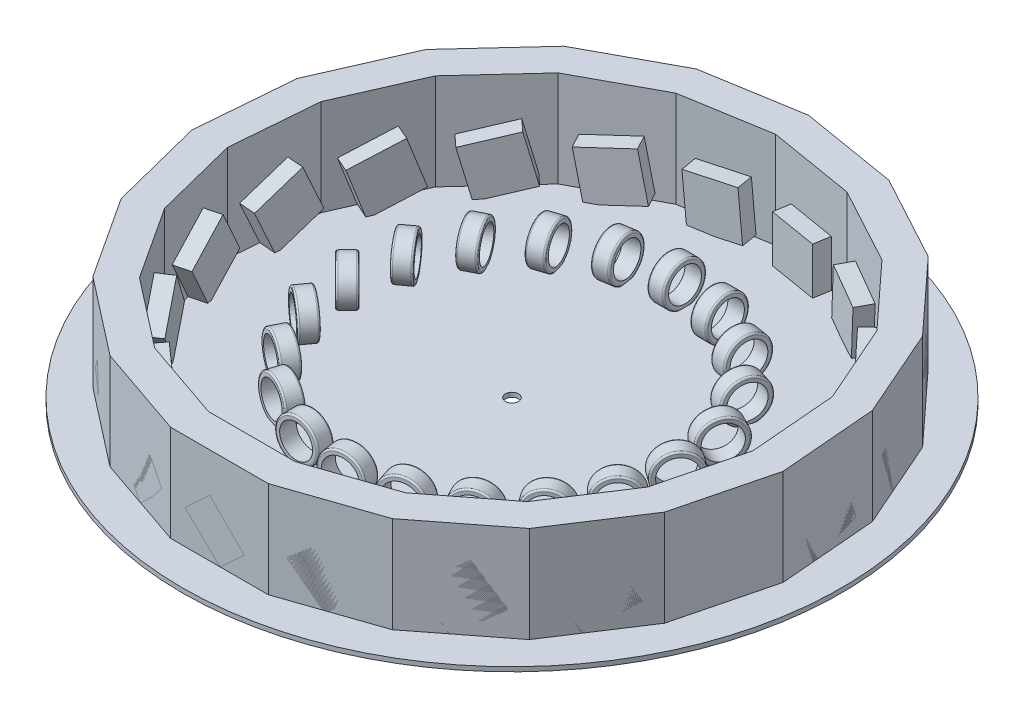
from build123d import *

# Parameters (mm, degrees)
SKETCH1_R                 = 100
SKETCH1_R_2               = 2.0000000000000018
BASE_PLATTER_DEPTH        = 0.75
CUBE_FACE_REFERENCE_DEPTH = 29.800000000000015
FIRST_CUBE_DEPTH          = 14.82
BOSS_EXTRUDE6_DEPTH       = 14.82
BOSS_EXTRUDE7_DEPTH       = 14.82
BOSS_EXTRUDE9_DEPTH       = 14.82
BOSS_EXTRUDE10_DEPTH      = 14.82
BOSS_EXTRUDE11_DEPTH      = 14.82
BOSS_EXTRUDE12_DEPTH      = 14.82
BOSS_EXTRUDE14_DEPTH      = 14.82
BOSS_EXTRUDE15_DEPTH      = 14.82
BOSS_EXTRUDE16_DEPTH      = 14.82
BOSS_EXTRUDE18_DEPTH      = 14.82
BOSS_EXTRUDE19_DEPTH      = 14.82
BOSS_EXTRUDE20_DEPTH      = 14.82
BOSS_EXTRUDE21_DEPTH      = 14.82
BOSS_EXTRUDE23_DEPTH      = 14.82
BOSS_EXTRUDE24_DEPTH      = 14.82
BOSS_EXTRUDE25_DEPTH      = 14.82
BOSS_EXTRUDE26_DEPTH      = 14.82
BOSS_EXTRUDE27_DEPTH      = 14.82
RINGS_DEPTH               = 13
SKETCH23_W                = 5.000000000000001
SKETCH23_H                = 13
RINGS_2_DEPTH             = 13
RINGS_3_DEPTH             = 13
RINGS_4_DEPTH             = 13
RINGS_5_DEPTH             = 13
RINGS_6_DEPTH             = 13
RINGS_7_DEPTH             = 13
RINGS_8_DEPTH             = 13
RINGS_9_DEPTH             = 13
RINGS_10_DEPTH            = 13
RINGS_11_DEPTH            = 13
RINGS_12_DEPTH            = 13
RINGS_13_DEPTH            = 13
RINGS_14_DEPTH            = 13
RINGS_15_DEPTH            = 13
RINGS_16_DEPTH            = 13
RINGS_17_DEPTH            = 13
RINGS_18_DEPTH            = 13
RINGS_19_DEPTH            = 13
RINGS_20_DEPTH            = 13
SKETCH26_R                = 4.999999999999997
CUT_EXTRUDE2_DEPTH        = 5
SKETCH27_R                = 4.999999999999997
CUT_EXTRUDE3_DEPTH        = 5
SKETCH28_R                = 4.999999999999997
CUT_EXTRUDE4_DEPTH        = 5
SKETCH29_R                = 4.999999999999997
CUT_EXTRUDE5_DEPTH        = 5
SKETCH30_R                = 4.999999999999997
CUT_EXTRUDE6_DEPTH        = 5
SKETCH31_R                = 4.999999999999997
CUT_EXTRUDE7_DEPTH        = 5
SKETCH32_R                = 4.999999999999997
CUT_EXTRUDE8_DEPTH        = 5
SKETCH33_R                = 5
CUT_EXTRUDE9_DEPTH        = 5
SKETCH34_R                = 4.999999999999998
CUT_EXTRUDE10_DEPTH       = 5
SKETCH35_R                = 4.999999999999998
CUT_EXTRUDE11_DEPTH       = 5
SKETCH36_R                = 5.000000000000003
CUT_EXTRUDE12_DEPTH       = 5
SKETCH37_R                = 5.0000000000000036
CUT_EXTRUDE13_DEPTH       = 5
SKETCH38_R                = 5
CUT_EXTRUDE14_DEPTH       = 5
SKETCH39_R                = 4.999999999999997
CUT_EXTRUDE15_DEPTH       = 5
SKETCH40_R                = 5
CUT_EXTRUDE16_DEPTH       = 5
SKETCH41_R                = 5
CUT_EXTRUDE17_DEPTH       = 5
SKETCH42_R                = 5.000000000000004
CUT_EXTRUDE18_DEPTH       = 5
SKETCH43_R                = 4.999999999999997
CUT_EXTRUDE19_DEPTH       = 5
SKETCH44_R                = 4.999999999999997
CUT_EXTRUDE20_DEPTH       = 5
SKETCH45_R                = 4.999999999999997
CUT_EXTRUDE21_DEPTH       = 5
SKETCH46_R                = 100
SKETCH46_R_2              = 2
BOSS_EXTRUDE29_DEPTH      = 0.6
FILLET1_R                 = 0.5


with BuildPart() as part:
    # Sketch1 → Base Platter (new body)
    with BuildSketch(Plane(origin=(0, 0, 0), x_dir=(1, 0, 0), z_dir=(0, 1, 0))):
        with Locations(Location((0, 0, 0), (0, 0, 270))):
            Circle(SKETCH1_R)
        with Locations(Location((0, 0, 0), (0, 0, 270))):
            Circle(SKETCH1_R_2, mode=Mode.SUBTRACT)
    extrude(amount=BASE_PLATTER_DEPTH)



with BuildPart() as body_2:
    # Sketch3 → Cube Face Reference (new body)
    with BuildSketch(Plane(origin=(0, 0.75, 0), x_dir=(1, 0, 0), z_dir=(0, 1, 0))):
        Polygon((2.429e-14, 90.00000000000001), (-29.222952228421583, 85.12355175305713), (-55.27914414207012, 71.02264584567544), (-75.34498304362761, 49.22533423101844), (-87.24602393453976, 22.093693842671932), (-89.69260437060031, -7.432141092509979), (-82.4195993989552, -36.152588218767285), (-66.21515196058188, -60.95534144631672), (-42.8352653733366, -79.15263760858409), (-14.813513125265956, -88.7725173062451), (14.813513125266049, -88.7725173062451), (42.83526537333665, -79.1526376085841), (66.21515196058186, -60.95534144631677), (82.41959939895521, -36.152588218767285), (89.69260437060034, -7.4321410925099265), (87.24602393453978, 22.09369384267194), (75.34498304362766, 49.225334231018365), (55.279144142070145, 71.02264584567543), (29.22295222842154, 85.12355175305714), align=None)
        Polygon((-2.776e-14, 80), (-25.97595753637474, 75.66537933605076), (-49.13701701517347, 63.131240751711445), (-66.9733182610023, 43.755852649794136), (-77.55202127514646, 19.638838971263908), (-79.7267594405336, -6.606347637786583), (-73.26186613240458, -32.13563397223765), (-58.85791285385055, -54.182525730059325), (-38.075791442965865, -70.3579000965192), (-13.1675672224587, -78.90890427221787), (13.167567222458729, -78.90890427221785), (38.075791442965894, -70.35790009651919), (58.85791285385056, -54.18252573005931), (73.2618661324046, -32.135633972237585), (79.72675944053361, -6.6063476377865165), (77.55202127514646, 19.63883897126394), (66.9733182610023, 43.75585264979415), (49.13701701517345, 63.13124075171147), (25.975957536374658, 75.66537933605078), align=None, mode=Mode.SUBTRACT)
    extrude(amount=CUBE_FACE_REFERENCE_DEPTH)


with BuildPart() as body_3:
    # Sketch4 → First Cube (new body)
    with BuildSketch(Plane(origin=(14.611476114210753, 0, -87.56177587652863), x_dir=(-0.9863613034027224, 0, -0.1645945902807338), z_dir=(0.1645945902807338, 0, -0.9863613034027224))):
        Polygon((-7.407500000000001, 0.75), (7.407500000000001, 0.75), (7.4075, 15.57), (-7.407500000000001, 15.57), align=None)
    extrude(amount=-FIRST_CUBE_DEPTH)


with BuildPart() as body_4:
    # Sketch5 → Boss-Extrude6 (new body)
    with BuildSketch(Plane(origin=(42.25104818524584, 0, -78.0730987993663), x_dir=(-0.879473751206489, 0, -0.4759473930370738), z_dir=(0.4759473930370738, 0, -0.879473751206489))):
        Polygon((-6.7727781432294405, 0.7500000000000014), (7.996604043129404, 1.9738258998999674), (6.77277814322944, 16.743208086258814), (-7.996604043129407, 15.519382186358849), align=None)
    extrude(amount=-BOSS_EXTRUDE6_DEPTH)


with BuildPart() as body_5:
    # Sketch6 → Boss-Extrude7 (new body)
    with BuildSketch(Plane(origin=(65.31206359284887, 0, -60.123990038346946), x_dir=(-0.6772815716257411, 0, -0.7357239106731317), z_dir=(0.7357239106731317, 0, -0.6772815716257411))):
        Polygon((-6.0892913442339935, 0.7500000000000014), (-8.528583172194372, 15.367874516428367), (6.089291344233993, 17.807166344388747), (8.528583172194367, 3.1892918279603784), align=None)
    extrude(amount=-BOSS_EXTRUDE7_DEPTH)


with BuildPart() as body_6:
    # Sketch7 → Boss-Extrude9 (new body)
    with BuildSketch(Plane(origin=(81.29550348908376, 0, -35.659514036845174), x_dir=(-0.4016954246529692, 0, -0.9157733266550576), z_dir=(0.9157733266550576, 0, -0.4016954246529692))):
        Polygon((-5.36420851089717, 0.75), (-9.002303430323744, 15.116511941220898), (5.364208510897154, 18.754606860647467), (9.002303430323721, 4.388094919426563), align=None)
    extrude(amount=-BOSS_EXTRUDE9_DEPTH)


with BuildPart() as body_7:
    # Sketch8 → Boss-Extrude10 (new body)
    with BuildSketch(Plane(origin=(88.46931415257009, 0, -7.330776375081016), x_dir=(-0.08257934547233238, 0, -0.9965844930066698), z_dir=(0.99658449300667, 0, -0.0825793454723324))):
        Polygon((-4.602482694195054, 0.75), (-9.414528827808395, 14.767011522003433), (4.602482694195035, 19.579057655616772), (9.414528827808367, 5.56204613361332), align=None)
    extrude(amount=-BOSS_EXTRUDE10_DEPTH)


with BuildPart() as body_8:
    # Sketch9 → Boss-Extrude11 (new body)
    with BuildSketch(Plane(origin=(86.05610188477782, 0, 21.792364655638615), x_dir=(0.24548548714079937, 0, -0.9694002659393304), z_dir=(0.9694002659393305, 0, 0.2454854871407994))):
        Polygon((3.8093172538355304, 20.274886894384913), (-9.76244344719246, 14.32176070102799), (-3.55e-15, 10.51244344719246), align=None)
        Polygon((-3.55e-15, 10.51244344719246), (9.762443447192455, 6.703126193356926), (3.80931725383553, 20.274886894384913), align=None)
        Polygon((-8.9e-16, 10.512443447192458), (-3.809317253835532, 0.7500000000000014), (9.762443447192455, 6.703126193356926), align=None)
        Polygon((-9.76244344719246, 14.32176070102799), (-3.809317253835532, 0.7500000000000014), (-8.9e-16, 10.512443447192458), align=None)
    extrude(amount=-BOSS_EXTRUDE11_DEPTH)


with BuildPart() as body_9:
    # Sketch10 → Boss-Extrude12 (new body)
    with BuildSketch(Plane(origin=(74.3173756797686, 0, 48.553964832542015), x_dir=(0.5469481581224269, 0, -0.8371664782625287), z_dir=(0.8371664782625287, 0, 0.5469481581224269))):
        Polygon((-2.990130314035431, 0.7500000000000022), (-10.043670678844782, 13.783800992880217), (2.9901303140354316, 20.83734135768956), (10.043670678844778, 7.803540364809351), align=None)
    extrude(amount=-BOSS_EXTRUDE12_DEPTH)


with BuildPart() as body_10:
    # Sketch11 → Boss-Extrude14 (new body)
    with BuildSketch(Plane(origin=(54.52520866695933, 0, 70.05398952745043), x_dir=(0.7891405093963932, 0, -0.6142127126896683), z_dir=(0.6142127126896683, 0, 0.7891405093963932))):
        Polygon((-2.1505177522381356, 0.7499999999999873), (-10.256289455612528, 13.156807207850639), (2.1505177522381262, 21.26257891122503), (10.256289455612519, 8.855771703374375), align=None)
    extrude(amount=-BOSS_EXTRUDE14_DEPTH)


with BuildPart() as body_11:
    # Sketch12 → Boss-Extrude15 (new body)
    with BuildSketch(Plane(origin=(28.82438924930138, 0, 83.96257745741461), x_dir=(0.9458172417006347, 0, -0.3246994692046836), z_dir=(0.3246994692046836, 0, 0.9458172417006347))):
        Polygon((-1.296214973596898, 0.750000000000002), (-10.398847375657711, 12.445062349254595), (1.296214973596889, 21.547694751315415), (10.3988473756577, 9.852632402060808), align=None)
    extrude(amount=-BOSS_EXTRUDE15_DEPTH)


with BuildPart() as body_12:
    # Sketch13 → Boss-Extrude16 (new body)
    with BuildSketch(Plane.XY.offset(88.7725173062451)):
        Polygon((-0.43305773234114836, 0.75), (-10.470370623834645, 11.653428356175802), (0.43305773234115635, 21.690741247669298), (10.470370623834652, 10.787312891493496), align=None)
    extrude(amount=-BOSS_EXTRUDE16_DEPTH)


with BuildPart() as body_13:
    # Sketch14 → Boss-Extrude18 (new body)
    with BuildSketch(Plane(origin=(-28.824389249301376, 0, 83.9625774574146), x_dir=(0.9458172417006347, 0, 0.3246994692046836), z_dir=(-0.3246994692046836, 0, 0.9458172417006347))):
        Polygon((0.43305773234112277, 0.75), (-10.470370623834645, 10.787312891493528), (-0.43305773234111367, 21.690741247669294), (10.470370623834652, 11.65342835617576), align=None)
    extrude(amount=-BOSS_EXTRUDE18_DEPTH)


with BuildPart() as body_14:
    # Sketch15 → Boss-Extrude19 (new body)
    with BuildSketch(Plane(origin=(-54.52520866695927, 0, 70.05398952745043), x_dir=(0.7891405093963937, 0, 0.6142127126896679), z_dir=(-0.6142127126896679, 0, 0.7891405093963937))):
        Polygon((1.2962149735968547, 0.7499999999999877), (-10.398847375657716, 9.852632402060836), (-1.296214973596866, 21.547694751315408), (10.398847375657706, 12.445062349254552), align=None)
    extrude(amount=-BOSS_EXTRUDE19_DEPTH)


with BuildPart() as body_15:
    # Sketch16 → Boss-Extrude20 (new body)
    with BuildSketch(Plane(origin=(-74.3173756797686, 0, 48.55396483254203), x_dir=(0.5469481581224271, 0, 0.8371664782625285), z_dir=(-0.8371664782625284, 0, 0.546948158122427))):
        Polygon((2.150517752238108, 0.7500000000000014), (-10.256289455612531, 8.855771703374419), (-2.150517752238109, 21.26257891122506), (10.256289455612528, 13.156807207850639), align=None)
    extrude(amount=-BOSS_EXTRUDE20_DEPTH)


with BuildPart() as body_16:
    # Sketch17 → Boss-Extrude21 (new body)
    with BuildSketch(Plane(origin=(-86.05610188477776, 0, 21.7923646556386), x_dir=(0.24548548714079926, 0, 0.9694002659393304), z_dir=(-0.9694002659393305, 0, 0.2454854871407993))):
        Polygon((2.9901303140353144, 0.7500000000000024), (-10.04367067884482, 7.8035403648095), (-2.99013031403532, 20.83734135768963), (10.043670678844812, 13.783800992880135), align=None)
    extrude(amount=-BOSS_EXTRUDE21_DEPTH)


with BuildPart() as body_17:
    # Sketch18 → Boss-Extrude23 (new body)
    with BuildSketch(Plane(origin=(-88.46931415257004, 0, -7.330776375080999), x_dir=(-0.08257934547233221, 0, 0.9965844930066698), z_dir=(-0.99658449300667, 0, -0.08257934547233223))):
        Polygon((3.8093172538354323, 0.7500000000000026), (-9.762443447192487, 6.703126193357057), (-3.809317253835426, 20.274886894384984), (9.7624434471925, 14.321760701027925), align=None)
    extrude(amount=-BOSS_EXTRUDE23_DEPTH)


with BuildPart() as body_18:
    # Sketch19 → Boss-Extrude24 (new body)
    with BuildSketch(Plane(origin=(-81.29550348908374, 0, -35.65951403684516), x_dir=(-0.40169542465296904, 0, 0.9157733266550577), z_dir=(-0.9157733266550576, 0, -0.401695424652969))):
        Polygon((4.602482694194955, 0.750000000000002), (-9.414528827808432, 5.5620461336134746), (-4.602482694194958, 19.579057655616857), (9.414528827808429, 14.767011522003386), align=None)
    extrude(amount=-BOSS_EXTRUDE24_DEPTH)


with BuildPart() as body_19:
    # Sketch20 → Boss-Extrude25 (new body)
    with BuildSketch(Plane(origin=(-65.31206359284884, 0, -60.12399003834697), x_dir=(-0.6772815716257413, 0, 0.7357239106731314), z_dir=(-0.7357239106731314, 0, -0.6772815716257413))):
        Polygon((5.364208510897141, 0.7500000000000011), (-9.002303430323746, 4.388094919426602), (-5.364208510897142, 18.75460686064749), (9.002303430323746, 15.116511941220885), align=None)
    extrude(amount=-BOSS_EXTRUDE25_DEPTH)


with BuildPart() as body_20:
    # Sketch21 → Boss-Extrude26 (new body)
    with BuildSketch(Plane(origin=(-42.251048185245864, 0, -78.07309879936632), x_dir=(-0.8794737512064889, 0, 0.47594739303707395), z_dir=(-0.47594739303707395, 0, -0.8794737512064889))):
        Polygon((6.089291344233902, 0.7499999999999994), (-8.528583172194436, 3.1892918279605356), (-6.089291344233897, 17.807166344388875), (8.528583172194441, 15.367874516428337), align=None)
    extrude(amount=-BOSS_EXTRUDE26_DEPTH)


with BuildPart() as body_21:
    # Sketch22 → Boss-Extrude27 (new body)
    with BuildSketch(Plane(origin=(-14.611476114210745, 0, -87.5617758765286), x_dir=(-0.9863613034027224, 0, 0.16459459028073373), z_dir=(-0.16459459028073373, 0, -0.9863613034027224))):
        Polygon((6.7727781432294645, 0.7499999999999885), (-7.9966040431293814, 1.9738258998998928), (-6.7727781432294725, 16.743208086258747), (7.996604043129378, 15.519382186358838), align=None)
    extrude(amount=-BOSS_EXTRUDE27_DEPTH)


with BuildPart() as body_22:
    # Sketch23 → Rings (new body)
    with BuildSketch(Plane(origin=(0, 0.75, 0), x_dir=(1, 0, 0), z_dir=(0, 1, 0))):
        Polygon((12.950849718747364, 54.052825814757675), (12.950849718747378, 41.05282581475768), (17.950849718747378, 41.05282581475769), (17.950849718747364, 54.05282581475769), align=None)
    extrude(amount=RINGS_DEPTH)

    # Sketch28 → Cut-Extrude4 (cut)
    with BuildSketch(Plane(origin=(17.950849718747424, 0, -1.916e-14), x_dir=(-1.6e-15, 0, -1), z_dir=(1, 0, -1.6e-15))):
        with BuildLine():
            Line((47.552825814758314, 13.75), (41.05282581475766, 13.75))
            Line((41.05282581475766, 13.75), (41.05282581475766, 7.250000000000003))
            ThreePointArc((41.052825814757654, 7.250000000000001), (42.95663173704533, 11.846194077712795), (47.552825814758314, 13.75))
        make_face()
        with BuildLine():
            ThreePointArc((47.55282581475831, 0.7499999999999991), (42.95663173704533, 2.6538059222872104), (41.052825814757654, 7.250000000000001))
            Line((41.05282581475766, 7.250000000000003), (41.05282581475766, 0.75))
            Line((41.05282581475766, 0.75), (47.55282581475831, 0.75))
        make_face()
        with Locations((47.552825814757654, 7.25)):
            Circle(SKETCH28_R)
        with BuildLine():
            Line((54.052825814757654, 13.75), (47.552825814758314, 13.75))
            ThreePointArc((47.552825814758314, 13.75), (52.14901989247045, 11.846194077712326), (54.052825814757654, 7.25))
            Line((54.052825814757654, 7.25), (54.052825814757654, 13.75))
        make_face()
        with BuildLine():
            Line((54.052825814757654, 0.75), (54.052825814757654, 7.25))
            ThreePointArc((54.052825814757654, 7.249999999999998), (52.14901989247045, 2.653805922287672), (47.55282581475831, 0.7499999999999991))
            Line((47.55282581475831, 0.75), (54.052825814757654, 0.75))
        make_face()
    extrude(amount=-CUT_EXTRUDE4_DEPTH, mode=Mode.SUBTRACT)


with BuildPart() as body_23:
    # Sketch23 → Rings 2 (new body)
    with BuildSketch(Plane(origin=(0, 0.75, 0), x_dir=(1, 0, 0), z_dir=(0, 1, 0))):
        with Locations((-1.78e-15, 50.00000000000001)):
            Rectangle(SKETCH23_W, SKETCH23_H)
    extrude(amount=RINGS_2_DEPTH)

    # Sketch27 → Cut-Extrude3 (cut)
    with BuildSketch(Plane(origin=(2.4999999999999987, 0, 0), x_dir=(0, 0, -1), z_dir=(1, 0, 0))):
        with Locations((50, 7.25)):
            Circle(SKETCH27_R)
        with BuildLine():
            Line((50.00000000000066, 13.75), (43.50000000000001, 13.75))
            Line((43.50000000000001, 13.75), (43.50000000000001, 7.249999999999998))
            ThreePointArc((43.5, 7.250000000000001), (45.403805922287674, 11.846194077712795), (50.00000000000066, 13.75))
        make_face()
        with BuildLine():
            ThreePointArc((50.000000000000654, 0.7499999999999991), (45.403805922287674, 2.6538059222872104), (43.5, 7.250000000000001))
            Line((43.50000000000001, 7.249999999999998), (43.50000000000001, 0.75))
            Line((43.50000000000001, 0.75), (50.000000000000654, 0.75))
        make_face()
        with BuildLine():
            Line((56.5, 13.75), (50.00000000000066, 13.75))
            ThreePointArc((50.00000000000066, 13.75), (54.596194077712795, 11.846194077712326), (56.5, 7.25))
            Line((56.5, 7.25), (56.5, 13.75))
        make_face()
        with BuildLine():
            Line((56.5, 0.75), (56.5, 7.25))
            ThreePointArc((56.5, 7.249999999999998), (54.596194077712795, 2.653805922287672), (50.000000000000654, 0.7499999999999991))
            Line((50.000000000000654, 0.75), (56.5, 0.75))
        make_face()
    extrude(amount=-CUT_EXTRUDE3_DEPTH, mode=Mode.SUBTRACT)


with BuildPart() as body_24:
    # Sketch23 → Rings 3 (new body)
    with BuildSketch(Plane(origin=(0, 0.75, 0), x_dir=(1, 0, 0), z_dir=(0, 1, 0))):
        Polygon((27.93686578589736, 47.26191009521636), (32.87530748887305, 46.47973777001518), (30.84165944334997, 33.639789342278405), (25.903217740374274, 34.421961667479586), align=None)
    extrude(amount=RINGS_3_DEPTH)

    # Sketch29 → Cut-Extrude5 (cut)
    with BuildSketch(Plane(origin=(24.889277018173086, 0, 3.94207421060584), x_dir=(0.15643446504023656, 0, -0.9876883405951369), z_dir=(0.9876883405951368, 0, 0.15643446504023653))):
        with Locations((44.55032620941853, 7.25)):
            Circle(SKETCH29_R)
        with BuildLine():
            Line((44.55032620941919, 13.75), (38.050326209418536, 13.75))
            Line((38.050326209418536, 13.75), (38.050326209418536, 7.249999999999996))
            ThreePointArc((38.05032620941853, 7.250000000000001), (39.9541321317062, 11.846194077712795), (44.55032620941919, 13.75))
        make_face()
        with BuildLine():
            ThreePointArc((44.55032620941918, 0.7499999999999991), (39.9541321317062, 2.6538059222872104), (38.05032620941853, 7.250000000000001))
            Line((38.050326209418536, 7.249999999999996), (38.050326209418536, 0.75))
            Line((38.050326209418536, 0.75), (44.55032620941918, 0.75))
        make_face()
        with BuildLine():
            Line((51.05032620941852, 0.75), (51.05032620941853, 7.25))
            ThreePointArc((51.05032620941853, 7.249999999999998), (49.146520287131324, 2.653805922287672), (44.55032620941918, 0.7499999999999991))
            Line((44.55032620941918, 0.75), (51.05032620941852, 0.75))
        make_face()
        with BuildLine():
            Line((51.05032620941853, 13.75), (44.55032620941919, 13.75))
            ThreePointArc((44.55032620941919, 13.75), (49.146520287131324, 11.846194077712326), (51.05032620941853, 7.25))
            Line((51.05032620941853, 7.25), (51.05032620941853, 13.75))
        make_face()
    extrude(amount=-CUT_EXTRUDE5_DEPTH, mode=Mode.SUBTRACT)


with BuildPart() as body_25:
    # Sketch23 → Rings 4 (new body)
    with BuildSketch(Plane(origin=(0, 0.75, 0), x_dir=(1, 0, 0), z_dir=(0, 1, 0))):
        Polygon((40.08181889144664, 36.343672456479524), (36.06459796457236, 23.979937744642513), (40.81988054604812, 22.434852772767794), (44.837101472922406, 34.798587484604795), align=None)
    extrude(amount=RINGS_4_DEPTH)

    # Sketch30 → Cut-Extrude6 (cut)
    with BuildSketch(Plane(origin=(30.32849100948537, 0, 9.854324086004343), x_dir=(0.3090169943749453, 0, -0.9510565162951543), z_dir=(0.9510565162951544, 0, 0.3090169943749453))):
        with BuildLine():
            Line((40.45084971874796, 13.75), (33.9508497187473, 13.75))
            Line((33.9508497187473, 13.75), (33.9508497187473, 7.250000000000006))
            ThreePointArc((33.9508497187473, 7.250000000000001), (35.854655641034974, 11.846194077712795), (40.45084971874796, 13.75))
        make_face()
        with BuildLine():
            ThreePointArc((40.45084971874795, 0.7499999999999991), (35.85465564103497, 2.6538059222872104), (33.9508497187473, 7.250000000000001))
            Line((33.9508497187473, 7.250000000000006), (33.9508497187473, 0.75))
            Line((33.9508497187473, 0.75), (40.45084971874795, 0.75))
        make_face()
        with Locations((40.4508497187473, 7.25)):
            Circle(SKETCH30_R)
        with BuildLine():
            Line((46.9508497187473, 13.75), (40.45084971874796, 13.75))
            ThreePointArc((40.45084971874796, 13.75), (45.047043796460095, 11.846194077712326), (46.9508497187473, 7.25))
            Line((46.9508497187473, 7.25), (46.9508497187473, 13.75))
        make_face()
        with BuildLine():
            Line((46.9508497187473, 0.75), (46.9508497187473, 7.25))
            ThreePointArc((46.9508497187473, 7.249999999999998), (45.04704379646009, 2.653805922287672), (40.45084971874795, 0.7499999999999991))
            Line((40.45084971874795, 0.75), (46.9508497187473, 0.75))
        make_face()
    extrude(amount=-CUT_EXTRUDE6_DEPTH, mode=Mode.SUBTRACT)


with BuildPart() as body_26:
    # Sketch23 → Rings 5 (new body)
    with BuildSketch(Plane(origin=(0, 0.75, 0), x_dir=(1, 0, 0), z_dir=(0, 1, 0))):
        Polygon((48.276247752593804, 22.377368375320636), (42.37437125597971, 10.794283560871845), (46.82940387692156, 8.524331062174118), (52.73128037353565, 20.10741587662291), align=None)
    extrude(amount=RINGS_5_DEPTH)

    # Sketch31 → Cut-Extrude7 (cut)
    with BuildSketch(Plane(origin=(33.72935407722357, 0, 17.185964297354), x_dir=(0.4539904997395454, 0, -0.8910065241883687), z_dir=(0.8910065241883686, 0, 0.45399049973954536))):
        with BuildLine():
            Line((35.35533905932799, 13.75), (28.85533905932733, 13.75))
            Line((28.85533905932733, 13.75), (28.85533905932733, 7.25))
            ThreePointArc((28.855339059327328, 7.250000000000001), (30.759144981615, 11.846194077712795), (35.35533905932799, 13.75))
        make_face()
        with BuildLine():
            ThreePointArc((35.35533905932798, 0.7499999999999991), (30.759144981614998, 2.6538059222872104), (28.855339059327328, 7.250000000000001))
            Line((28.85533905932733, 7.25), (28.85533905932733, 0.75))
            Line((28.85533905932733, 0.75), (35.35533905932798, 0.75))
        make_face()
        with Locations((35.35533905932733, 7.25)):
            Circle(SKETCH31_R)
        with BuildLine():
            Line((41.855339059327335, 13.75), (35.35533905932799, 13.75))
            ThreePointArc((35.35533905932799, 13.75), (39.95153313704012, 11.846194077712326), (41.85533905932733, 7.25))
            Line((41.855339059327335, 7.25), (41.855339059327335, 13.75))
        make_face()
        with BuildLine():
            Line((41.85533905932733, 0.75), (41.855339059327335, 7.25))
            ThreePointArc((41.85533905932733, 7.249999999999998), (39.951533137040116, 2.653805922287672), (35.35533905932798, 0.7499999999999991))
            Line((35.35533905932798, 0.75), (41.85533905932733, 0.75))
        make_face()
    extrude(amount=-CUT_EXTRUDE7_DEPTH, mode=Mode.SUBTRACT)


with BuildPart() as body_27:
    # Sketch23 → Rings 6 (new body)
    with BuildSketch(Plane(origin=(0, 0.75, 0), x_dir=(1, 0, 0), z_dir=(0, 1, 0))):
        Polygon((51.79806165396369, 6.7280735941683485), (44.156853374161564, -3.789147332705984), (48.20193834603631, -6.728073594168339), (55.84314662583844, 3.7891473327059897), align=None)
    extrude(amount=RINGS_6_DEPTH)

    # Sketch32 → Cut-Extrude8 (cut)
    with BuildSketch(Plane(origin=(34.74796734531116, 0, 25.245876038109998), x_dir=(0.5877852522924715, 0, -0.8090169943749487), z_dir=(0.8090169943749487, 0, 0.5877852522924715))):
        with BuildLine():
            Line((29.389262614624226, 13.75), (22.889262614623572, 13.75))
            Line((22.889262614623572, 13.75), (22.889262614623572, 7.2500000000000036))
            ThreePointArc((22.889262614623565, 7.250000000000001), (24.793068536911242, 11.846194077712795), (29.389262614624226, 13.75))
        make_face()
        with BuildLine():
            ThreePointArc((29.38926261462421, 0.7499999999999991), (24.793068536911232, 2.653805922287213), (22.889262614623565, 7.250000000000001))
            Line((22.889262614623572, 7.2500000000000036), (22.889262614623572, 0.75))
            Line((22.889262614623572, 0.75), (29.389262614624215, 0.75))
        make_face()
        with Locations((29.389262614623565, 7.25)):
            Circle(SKETCH32_R)
        with BuildLine():
            Line((35.889262614623576, 13.75), (29.389262614624226, 13.75))
            ThreePointArc((29.389262614624226, 13.75), (33.985456692336356, 11.846194077712326), (35.88926261462357, 7.25))
            Line((35.889262614623576, 7.25), (35.889262614623576, 13.75))
        make_face()
        with BuildLine():
            Line((35.88926261462357, 0.75), (35.889262614623576, 7.25))
            ThreePointArc((35.88926261462357, 7.249999999999998), (33.98545669233635, 2.6538059222876678), (29.38926261462421, 0.7499999999999991))
            Line((29.389262614624215, 0.75), (35.88926261462357, 0.75))
        make_face()
    extrude(amount=-CUT_EXTRUDE8_DEPTH, mode=Mode.SUBTRACT)


with BuildPart() as body_28:
    # Sketch23 → Rings 7 (new body)
    with BuildSketch(Plane(origin=(0, 0.75, 0), x_dir=(1, 0, 0), z_dir=(0, 1, 0))):
        Polygon((50.38125293950386, -9.08688868806843), (41.18886478407877, -18.279276843493562), (44.72439869001151, -21.8148107494263), (53.916786845436604, -12.622422594001156), align=None)
    extrude(amount=RINGS_7_DEPTH)

    # Sketch33 → Cut-Extrude9 (cut)
    with BuildSketch(Plane(origin=(33.26960471971901, 0, 33.26960471971885), x_dir=(0.7071067811865459, 0, -0.7071067811865492), z_dir=(0.7071067811865492, 0, 0.7071067811865459))):
        with BuildLine():
            Line((22.69952498697788, 13.75), (16.19952498697722, 13.75))
            Line((16.19952498697722, 13.75), (16.19952498697722, 7.249999999999998))
            ThreePointArc((16.19952498697722, 7.250000000000001), (18.103330909264898, 11.846194077712795), (22.69952498697788, 13.75))
        make_face()
        with BuildLine():
            ThreePointArc((22.699524986977867, 0.7499999999999991), (18.103330909264887, 2.653805922287213), (16.19952498697722, 7.250000000000001))
            Line((16.19952498697722, 7.249999999999998), (16.19952498697722, 0.75))
            Line((16.19952498697722, 0.75), (22.69952498697787, 0.75))
        make_face()
        with Locations((22.69952498697722, 7.25)):
            Circle(SKETCH33_R)
        with BuildLine():
            Line((29.19952498697722, 13.75), (22.69952498697788, 13.75))
            ThreePointArc((22.69952498697788, 13.75), (27.295719064690015, 11.846194077712326), (29.19952498697722, 7.25))
            Line((29.19952498697722, 7.25), (29.19952498697722, 13.75))
        make_face()
        with BuildLine():
            Line((29.19952498697722, 0.75), (29.19952498697722, 7.25))
            ThreePointArc((29.19952498697722, 7.249999999999998), (27.295719064690008, 2.6538059222876678), (22.699524986977867, 0.7499999999999991))
            Line((22.69952498697787, 0.75), (29.19952498697722, 0.75))
        make_face()
    extrude(amount=-CUT_EXTRUDE9_DEPTH, mode=Mode.SUBTRACT)


with BuildPart() as body_29:
    # Sketch23 → Rings 8 (new body)
    with BuildSketch(Plane(origin=(0, 0.75, 0), x_dir=(1, 0, 0), z_dir=(0, 1, 0))):
        Polygon((44.23999705145333, -23.546115988785207), (33.72277612457904, -31.187324268587382), (36.661702386041426, -35.23240924046211), (47.178923312915714, -27.59120096065992), align=None)
    extrude(amount=RINGS_8_DEPTH)

    # Sketch34 → Cut-Extrude10 (cut)
    with BuildSketch(Plane(origin=(29.420312849478744, 0, 40.493586700628), x_dir=(0.8090169943749453, 0, -0.587785252292476), z_dir=(0.587785252292476, 0, 0.8090169943749453))):
        with BuildLine():
            ThreePointArc((15.450849718747847, 0.7499999999999964), (10.854655641034867, 2.6538059222872112), (8.950849718747198, 7.250000000000001))
            Line((8.950849718747206, 7.249999999999997), (8.950849718747206, 0.75))
            Line((8.950849718747206, 0.75), (15.450849718747847, 0.75))
        make_face()
        with BuildLine():
            Line((15.450849718747865, 13.75), (8.950849718747204, 13.75))
            Line((8.950849718747204, 13.75), (8.950849718747206, 7.249999999999997))
            ThreePointArc((8.950849718747198, 7.250000000000001), (10.854655641034874, 11.846194077712795), (15.450849718747865, 13.750000000000004))
        make_face()
        with Locations((15.450849718747202, 7.25)):
            Circle(SKETCH34_R)
        with BuildLine():
            Line((21.950849718747204, 13.75), (15.450849718747865, 13.75))
            ThreePointArc((15.450849718747865, 13.750000000000004), (20.04704379646, 11.846194077712326), (21.950849718747207, 7.25))
            Line((21.9508497187472, 7.25), (21.950849718747204, 13.75))
        make_face()
        with BuildLine():
            Line((21.9508497187472, 0.75), (21.9508497187472, 7.25))
            ThreePointArc((21.950849718747207, 7.249999999999998), (20.04704379645999, 2.653805922287666), (15.450849718747847, 0.7499999999999964))
            Line((15.450849718747847, 0.75), (21.9508497187472, 0.75))
        make_face()
    extrude(amount=-CUT_EXTRUDE10_DEPTH, mode=Mode.SUBTRACT)


with BuildPart() as body_30:
    # Sketch23 → Rings 9 (new body)
    with BuildSketch(Plane(origin=(0, 0.75, 0), x_dir=(1, 0, 0), z_dir=(0, 1, 0))):
        Polygon((24.732696456748155, -45.62930427752535), (36.31578127119692, -39.727427780911206), (34.04582877249917, -35.27239515996938), (22.462743958050414, -41.17427165658352), align=None)
    extrude(amount=RINGS_9_DEPTH)

    # Sketch35 → Cut-Extrude11 (cut)
    with BuildSketch(Plane(origin=(23.555032416034535, 0, 46.22935407722339), x_dir=(0.8910065241883667, 0, -0.4539904997395491), z_dir=(0.4539904997395491, 0, 0.8910065241883667))):
        with BuildLine():
            ThreePointArc((7.821723265308285, 0.7499999999999982), (3.2255291813504767, 2.6538059152358437), (1.3217232520114388, 7.249999993351919))
            Line((1.3217232520114406, 7.249999993351918), (1.3217232520114413, 0.75))
            Line((1.3217232520114413, 0.75), (7.821723265308285, 0.75))
        make_face()
        with BuildLine():
            Line((7.821723252012102, 13.75), (1.32172325201144, 13.75))
            Line((1.32172325201144, 13.75), (1.3217232520114406, 7.249999993351918))
            ThreePointArc((1.3217232520114388, 7.249999993351919), (3.2255291719486614, 11.846194075362341), (7.821723252012102, 13.750000000000002))
        make_face()
        with Locations((7.821723252011441, 7.25)):
            Circle(SKETCH35_R)
        with BuildLine():
            Line((14.32172325201144, 13.75), (7.821723252012102, 13.75))
            ThreePointArc((7.821723252012102, 13.750000000000002), (12.417917329724235, 11.846194077712326), (14.321723252011441, 7.25))
            Line((14.321723252011441, 7.25), (14.32172325201144, 13.75))
        make_face()
        with BuildLine():
            Line((14.321723252011441, 0.75), (14.321723252011441, 7.25))
            ThreePointArc((14.321723252011441, 7.249999999999998), (12.417917334425145, 2.653805926988583), (7.821723265308285, 0.7499999999999982))
            Line((7.821723265308285, 0.75), (14.321723252011441, 0.75))
        make_face()
    extrude(amount=-CUT_EXTRUDE11_DEPTH, mode=Mode.SUBTRACT)


with BuildPart() as body_31:
    # Sketch23 → Rings 10 (new body)
    with BuildSketch(Plane(origin=(0, 0.75, 0), x_dir=(1, 0, 0), z_dir=(0, 1, 0))):
        Polygon((10.041524848766262, -51.93907756893273), (22.40525956060324, -47.92185664205839), (20.860174588728487, -43.16657406058262), (8.49643987689151, -47.18379498745698), align=None)
    extrude(amount=RINGS_10_DEPTH)

    # Sketch36 → Cut-Extrude12 (cut)
    with BuildSketch(Plane(origin=(16.22339220468489, 0, 49.93046710549556), x_dir=(0.9510565162951524, 0, -0.30901699437495117), z_dir=(0.3090169943749511, 0, 0.9510565162951523))):
        with BuildLine():
            Line((6.6169e-13, 13.75), (-6.500000000000188, 13.75))
            Line((-6.500000000000188, 13.75), (-6.500000000000187, 7.249999999999998))
            ThreePointArc((-6.500000000000002, 7.250000000000001), (-4.596194077712328, 11.846194077712793), (6.6142e-13, 13.750000000000002))
        make_face()
        with BuildLine():
            ThreePointArc((-4.302674869e-08, 0.7499999999999982), (-4.596194092924813, 2.653805937499693), (-6.500000000000002, 7.250000000000001))
            Line((-6.500000000000187, 7.249999999999998), (-6.5000000000001865, 0.75))
            Line((-6.5000000000001865, 0.75), (-4.302674839e-08, 0.75))
        make_face()
        with Locations((0, 7.25)):
            Circle(SKETCH36_R)
        with BuildLine():
            Line((6.49999999999981, 0.75), (6.499999999999811, 7.25))
            ThreePointArc((6.500000000000002, 7.249999999999998), (4.596194062500307, 2.6538059070751867), (-4.302674869e-08, 0.7499999999999982))
            Line((-4.302674839e-08, 0.75), (6.49999999999981, 0.75))
        make_face()
        with BuildLine():
            Line((6.499999999999812, 13.75), (6.6169e-13, 13.75))
            ThreePointArc((6.6142e-13, 13.750000000000002), (4.596194077712794, 11.846194077712326), (6.500000000000002, 7.25))
            Line((6.499999999999811, 7.25), (6.499999999999812, 13.75))
        make_face()
    extrude(amount=-CUT_EXTRUDE12_DEPTH, mode=Mode.SUBTRACT)


with BuildPart() as body_32:
    # Sketch23 → Rings 11 (new body)
    with BuildSketch(Plane(origin=(0, 0.75, 0), x_dir=(1, 0, 0), z_dir=(0, 1, 0))):
        Polygon((-6.0288880512678, -53.48604487424937), (6.811060376468982, -51.45239682872633), (6.02888805126781, -46.51395512575064), (-6.811060376468971, -48.547603171273686), align=None)
    extrude(amount=RINGS_11_DEPTH)

    # Sketch37 → Cut-Extrude13 (cut)
    with BuildSketch(Plane(origin=(8.116511021974425, 0, 51.24563375886664), x_dir=(0.9876883405951373, 0, -0.156434465040234), z_dir=(0.156434465040234, 0, 0.9876883405951373))):
        with BuildLine():
            Line((-14.321723252011694, 13.75), (-14.321723252011694, 7.250000000000006))
            ThreePointArc((-14.321723252011697, 7.250000000000001), (-12.417917329724235, 11.846194077712582), (-7.821723252011638, 13.750000000000002))
            Line((-7.821723252011638, 13.750000000000002), (-14.321723252011694, 13.75))
        make_face()
        with BuildLine():
            Line((-14.321723252011694, 0.7499999999999983), (-7.821723245362948, 0.7499999999999992))
            ThreePointArc((-7.821723245362951, 0.7499999999999982), (-12.41791732737357, 2.6538059199367536), (-14.321723252011697, 7.250000000000001))
            Line((-14.321723252011694, 7.250000000000006), (-14.321723252011694, 0.7499999999999983))
        make_face()
        with Locations((-7.8217232520116955, 7.25)):
            Circle(SKETCH37_R)
        with BuildLine():
            ThreePointArc((-7.821723252011639, 13.750000000000002), (-3.2255291742991155, 11.84619407771254), (-1.3217232520116937, 7.25))
            Line((-1.3217232520116955, 7.25), (-1.3217232520116964, 13.750000000000004))
            Line((-1.3217232520116964, 13.750000000000004), (-7.821723252011638, 13.750000000000002))
        make_face()
        with BuildLine():
            Line((-7.821723245362948, 0.7499999999999992), (-1.3217232520116948, 0.75))
            Line((-1.3217232520116948, 0.75), (-1.3217232520116955, 7.25))
            ThreePointArc((-1.3217232520116937, 7.249999999999998), (-3.2255291719484473, 2.653805924638127), (-7.821723245362951, 0.7499999999999982))
        make_face()
    extrude(amount=-CUT_EXTRUDE13_DEPTH, mode=Mode.SUBTRACT)


with BuildPart() as body_33:
    # Sketch23 → Rings 12 (new body)
    with BuildSketch(Plane(origin=(0, 0.75, 0), x_dir=(1, 0, 0), z_dir=(0, 1, 0))):
        Polygon((-21.950849718747353, -50.0528258147577), (-8.950849718747358, -50.05282581475765), (-8.950849718747381, -45.05282581475765), (-21.950849718747378, -45.05282581475771), align=None)
    extrude(amount=RINGS_12_DEPTH)

    # Sketch38 → Cut-Extrude14 (cut)
    with BuildSketch(Plane.XY.offset(50.052825814757604)):
        with BuildLine():
            Line((-15.450849718746888, 13.75), (-21.950849718747563, 13.75))
            Line((-21.950849718747563, 13.75), (-21.950849718747563, 7.250000000000006))
            ThreePointArc((-21.950849718747563, 7.250000000000001), (-20.04704379645988, 11.846194077712799), (-15.450849718746888, 13.75))
        make_face()
        with BuildLine():
            ThreePointArc((-15.450849718746896, 0.7500000000000009), (-20.047043796459885, 2.653805922287205), (-21.950849718747563, 7.250000000000001))
            Line((-21.950849718747563, 7.250000000000006), (-21.950849718747563, 0.75))
            Line((-21.950849718747563, 0.75), (-15.450849718746896, 0.75))
        make_face()
        with Locations((-15.450849718747564, 7.25)):
            Circle(SKETCH38_R)
        with BuildLine():
            Line((-8.950849718747563, 13.75), (-15.450849718746888, 13.75))
            ThreePointArc((-15.450849718746888, 13.75), (-10.854655641034768, 11.846194077712319), (-8.950849718747566, 7.25))
            Line((-8.950849718747563, 7.25), (-8.950849718747563, 13.75))
        make_face()
        with BuildLine():
            Line((-8.950849718747564, 0.75), (-8.950849718747563, 7.25))
            ThreePointArc((-8.950849718747566, 7.249999999999998), (-10.854655641034771, 2.6538059222876775), (-15.450849718746896, 0.7500000000000009))
            Line((-15.450849718746896, 0.75), (-8.950849718747564, 0.75))
        make_face()
    extrude(amount=-CUT_EXTRUDE14_DEPTH, mode=Mode.SUBTRACT)


with BuildPart() as body_34:
    # Sketch23 → Rings 13 (new body)
    with BuildSketch(Plane(origin=(0, 0.75, 0), x_dir=(1, 0, 0), z_dir=(0, 1, 0))):
        Polygon((-36.343672456479524, -40.81988054604816), (-23.979937744642502, -44.83710147292241), (-22.434852772767787, -40.08181889144664), (-34.798587484604816, -36.064597964572386), align=None)
    extrude(amount=RINGS_13_DEPTH)

    # Sketch39 → Cut-Extrude15 (cut)
    with BuildSketch(Plane(origin=(-15.467173793248943, 0, 47.60306615011162), x_dir=(0.9510565162951552, 0, 0.3090169943749427), z_dir=(-0.3090169943749426, 0, 0.9510565162951551))):
        with BuildLine():
            Line((-15.450849718746932, 13.75), (-21.950849718747605, 13.75))
            Line((-21.950849718747605, 13.75), (-21.950849718747605, 7.250000000000001))
            ThreePointArc((-21.95084971874761, 7.250000000000001), (-20.047043796459928, 11.846194077712799), (-15.450849718746932, 13.75))
        make_face()
        with BuildLine():
            ThreePointArc((-15.450849718746941, 0.7500000000000009), (-20.04704379645993, 2.653805922287205), (-21.95084971874761, 7.250000000000001))
            Line((-21.950849718747605, 7.250000000000001), (-21.950849718747605, 0.75))
            Line((-21.950849718747605, 0.75), (-15.450849718746941, 0.75))
        make_face()
        with BuildLine():
            Line((-8.950849718747605, 13.75), (-15.450849718746932, 13.75))
            ThreePointArc((-15.450849718746932, 13.75), (-10.85465564103481, 11.846194077712319), (-8.950849718747609, 7.25))
            Line((-8.950849718747609, 7.25), (-8.950849718747605, 13.75))
        make_face()
        with Locations((-15.450849718747609, 7.25)):
            Circle(SKETCH39_R)
        with BuildLine():
            Line((-8.950849718747614, 0.75), (-8.950849718747609, 7.25))
            ThreePointArc((-8.950849718747609, 7.249999999999998), (-10.854655641034814, 2.6538059222876775), (-15.450849718746941, 0.7500000000000009))
            Line((-15.450849718746941, 0.75), (-8.950849718747614, 0.75))
        make_face()
    extrude(amount=-CUT_EXTRUDE15_DEPTH, mode=Mode.SUBTRACT)


with BuildPart() as body_35:
    # Sketch23 → Rings 14 (new body)
    with BuildSketch(Plane(origin=(0, 0.75, 0), x_dir=(1, 0, 0), z_dir=(0, 1, 0))):
        Polygon((-47.377368375320636, -28.66584067678756), (-35.794283560871826, -34.56771717340162), (-33.52433106217411, -30.11268455245976), (-45.10741587662292, -24.210808055845714), align=None)
    extrude(amount=RINGS_14_DEPTH)

    # Sketch40 → Cut-Extrude16 (cut)
    with BuildSketch(Plane(origin=(-21.36040110872232, 0, 41.92214761778279), x_dir=(0.8910065241883703, 0, 0.45399049973954203), z_dir=(-0.453990499739542, 0, 0.8910065241883702))):
        with BuildLine():
            Line((-22.699524986976915, 13.75), (-29.19952498697757, 13.75))
            Line((-29.19952498697757, 13.75), (-29.19952498697757, 7.249999999999997))
            ThreePointArc((-29.199524986977575, 7.250000000000001), (-27.295719064689898, 11.846194077712795), (-22.699524986976915, 13.75))
        make_face()
        with BuildLine():
            Line((-16.19952498697757, 13.75), (-22.699524986976915, 13.75))
            ThreePointArc((-22.699524986976915, 13.75), (-18.10333090926478, 11.846194077712326), (-16.199524986977575, 7.25))
            Line((-16.199524986977572, 7.25), (-16.19952498697757, 13.75))
        make_face()
        with Locations((-22.699524986977575, 7.25)):
            Circle(SKETCH40_R)
        with BuildLine():
            Line((-16.19952498697758, 0.75), (-16.199524986977572, 7.25))
            ThreePointArc((-16.199524986977575, 7.249999999999998), (-18.103330909264788, 2.6538059222876678), (-22.69952498697693, 0.7499999999999991))
            Line((-22.699524986976925, 0.75), (-16.19952498697758, 0.75))
        make_face()
        with BuildLine():
            ThreePointArc((-22.69952498697693, 0.7499999999999991), (-27.29571906468991, 2.653805922287213), (-29.199524986977575, 7.250000000000001))
            Line((-29.19952498697757, 7.249999999999997), (-29.19952498697757, 0.75))
            Line((-29.19952498697757, 0.75), (-22.699524986976925, 0.75))
        make_face()
    extrude(amount=-CUT_EXTRUDE16_DEPTH, mode=Mode.SUBTRACT)


with BuildPart() as body_36:
    # Sketch23 → Rings 15 (new body)
    with BuildSketch(Plane(origin=(0, 0.75, 0), x_dir=(1, 0, 0), z_dir=(0, 1, 0))):
        Polygon((-54.28089940892603, -13.652788064783714), (-43.76367848205167, -21.293996344585803), (-40.824752220589325, -17.248911372711042), (-51.34197314746369, -9.60770309290896), align=None)
    extrude(amount=RINGS_15_DEPTH)

    # Sketch41 → Cut-Extrude17 (cut)
    with BuildSketch(Plane(origin=(-25.24587603810973, 0, 34.747967345311075), x_dir=(0.809016994374951, 0, 0.5877852522924681), z_dir=(-0.5877852522924681, 0, 0.809016994374951))):
        with BuildLine():
            Line((-22.88926261462391, 13.75), (-29.389262614623274, 13.75))
            ThreePointArc((-29.389262614623274, 13.749999999999996), (-24.79306853691112, 11.846194077712335), (-22.889262614623906, 7.25))
            Line((-22.889262614623906, 7.25), (-22.88926261462391, 13.75))
        make_face()
        with BuildLine():
            Line((-29.389262614623274, 13.75), (-35.8892626146239, 13.75))
            Line((-35.8892626146239, 13.75), (-35.8892626146239, 7.2499999825950505))
            ThreePointArc((-35.8892626146239, 7.24999998259505), (-33.98545669848981, 11.8461940715592), (-29.389262614623274, 13.749999999999996))
        make_face()
        with Locations((-29.389262614623902, 7.25)):
            Circle(SKETCH41_R)
        with BuildLine():
            Line((-22.889262614623902, 0.75), (-22.889262614623906, 7.25))
            ThreePointArc((-22.889262614623906, 7.249999999999998), (-24.793068536911118, 2.6538059222876704), (-29.389262614623256, 0.7500000000000027))
            Line((-29.389262614623252, 0.75), (-22.889262614623902, 0.75))
        make_face()
        with BuildLine():
            ThreePointArc((-29.389262614623256, 0.7500000000000027), (-33.98545668618265, 2.653805916133636), (-35.8892626146239, 7.24999998259505))
            Line((-35.8892626146239, 7.2499999825950505), (-35.8892626146239, 0.75))
            Line((-35.8892626146239, 0.75), (-29.389262614623252, 0.75))
        make_face()
    extrude(amount=-CUT_EXTRUDE17_DEPTH, mode=Mode.SUBTRACT)


with BuildPart() as body_37:
    # Sketch23 → Rings 16 (new body)
    with BuildSketch(Plane(origin=(0, 0.75, 0), x_dir=(1, 0, 0), z_dir=(0, 1, 0))):
        Polygon((-56.363961030678944, 2.82842712474614), (-47.17157287525377, -6.363961030678915), (-43.636038969321056, -2.828427124746161), (-52.828427124746234, 6.363961030678904), align=None)
    extrude(amount=RINGS_16_DEPTH)

    # Sketch42 → Cut-Extrude18 (cut)
    with BuildSketch(Plane(origin=(-26.76776695296606, 0, 26.767766952966383), x_dir=(0.7071067811865516, 0, 0.7071067811865435), z_dir=(-0.7071067811865435, 0, 0.7071067811865516))):
        with BuildLine():
            Line((-35.35533905932691, 13.75), (-41.85533905932756, 13.75))
            Line((-41.85533905932756, 13.75), (-41.85533905932756, 7.249999999999998))
            ThreePointArc((-41.85533905932757, 7.250000000000001), (-39.951533137039895, 11.846194077712795), (-35.35533905932691, 13.75))
        make_face()
        with BuildLine():
            Line((-28.855339059327566, 13.75), (-35.35533905932691, 13.75))
            ThreePointArc((-35.35533905932691, 13.75), (-30.759144981614774, 11.846194077712326), (-28.85533905932757, 7.25))
            Line((-28.85533905932757, 7.25), (-28.855339059327566, 13.75))
        make_face()
        with Locations((-35.35533905932757, 7.25)):
            Circle(SKETCH42_R)
        with BuildLine():
            Line((-28.855339059327573, 0.75), (-28.85533905932757, 7.25))
            ThreePointArc((-28.85533905932757, 7.249999999999998), (-30.759144981614778, 2.653805922287672), (-35.355339059326916, 0.7499999999999991))
            Line((-35.355339059326916, 0.75), (-28.855339059327573, 0.75))
        make_face()
        with BuildLine():
            ThreePointArc((-35.355339059326916, 0.7499999999999991), (-39.9515331370399, 2.6538059222872104), (-41.85533905932757, 7.250000000000001))
            Line((-41.85533905932756, 7.249999999999998), (-41.85533905932756, 0.75))
            Line((-41.85533905932756, 0.75), (-35.355339059326916, 0.75))
        make_face()
    extrude(amount=-CUT_EXTRUDE18_DEPTH, mode=Mode.SUBTRACT)


with BuildPart() as body_38:
    # Sketch23 → Rings 17 (new body)
    with BuildSketch(Plane(origin=(0, 0.75, 0), x_dir=(1, 0, 0), z_dir=(0, 1, 0))):
        Polygon((-53.39597244059615, 19.2399970514533), (-45.75476416079394, 8.722776124579035), (-41.70967918891921, 11.661702386041432), (-49.35088746872143, 22.178923312915696), align=None)
    extrude(amount=RINGS_17_DEPTH)

    # Sketch43 → Cut-Extrude19 (cut)
    with BuildSketch(Plane(origin=(-25.798955393315918, 0, 18.744038271357525), x_dir=(0.5877852522924778, 0, 0.8090169943749441), z_dir=(-0.8090169943749442, 0, 0.5877852522924778))):
        with BuildLine():
            Line((-33.950849718747534, 0.75), (-33.950849718747534, 7.25))
            ThreePointArc((-33.950849718747534, 7.249999999999998), (-35.85465564103474, 2.653805922287672), (-40.45084971874688, 0.7499999999999991))
            Line((-40.45084971874688, 0.75), (-33.950849718747534, 0.75))
        make_face()
        with BuildLine():
            Line((-33.95084971874753, 13.75), (-40.45084971874687, 13.75))
            ThreePointArc((-40.45084971874687, 13.75), (-35.85465564103474, 11.846194077712326), (-33.950849718747534, 7.25))
            Line((-33.950849718747534, 7.25), (-33.95084971874753, 13.75))
        make_face()
        with Locations((-40.450849718747534, 7.25)):
            Circle(SKETCH43_R)
        with BuildLine():
            Line((-40.45084971874687, 13.75), (-46.95084971874752, 13.75))
            Line((-46.95084971874752, 13.75), (-46.95084971874752, 7.250000000000002))
            ThreePointArc((-46.950849718747534, 7.250000000000001), (-45.04704379645986, 11.846194077712795), (-40.45084971874687, 13.75))
        make_face()
        with BuildLine():
            ThreePointArc((-40.45084971874688, 0.7499999999999991), (-45.04704379645986, 2.6538059222872104), (-46.950849718747534, 7.250000000000001))
            Line((-46.95084971874752, 7.250000000000002), (-46.95084971874752, 0.75))
            Line((-46.95084971874752, 0.75), (-40.45084971874688, 0.75))
        make_face()
    extrude(amount=-CUT_EXTRUDE19_DEPTH, mode=Mode.SUBTRACT)


with BuildPart() as body_39:
    # Sketch23 → Rings 18 (new body)
    with BuildSketch(Plane(origin=(0, 0.75, 0), x_dir=(1, 0, 0), z_dir=(0, 1, 0))):
        Polygon((-45.629304277525385, 34.04582877249914), (-39.727427780911206, 22.462743958050392), (-35.27239515996938, 24.73269645674816), (-41.174271656583564, 36.315781271196904), align=None)
    extrude(amount=RINGS_18_DEPTH)

    # Sketch44 → Cut-Extrude20 (cut)
    with BuildSketch(Plane(origin=(-22.452941169844305, 0, 11.44034494203706), x_dir=(0.4539904997395526, 0, 0.891006524188365), z_dir=(-0.891006524188365, 0, 0.4539904997395526))):
        with BuildLine():
            ThreePointArc((-44.55032620941788, 0.7499999999999991), (-49.14652028713087, 2.6538059222872104), (-51.050326209418536, 7.250000000000001))
            Line((-51.050326209418536, 7.250000000000006), (-51.050326209418536, 0.75))
            Line((-51.050326209418536, 0.75), (-44.55032620941788, 0.75))
        make_face()
        with BuildLine():
            Line((-38.05032620941854, 0.75), (-38.05032620941854, 7.25))
            ThreePointArc((-38.050326209418536, 7.249999999999998), (-39.95413213170575, 2.653805922287672), (-44.55032620941788, 0.7499999999999991))
            Line((-44.55032620941788, 0.75), (-38.05032620941854, 0.75))
        make_face()
        with BuildLine():
            Line((-38.05032620941854, 13.75), (-44.550326209417875, 13.75))
            ThreePointArc((-44.550326209417875, 13.75), (-39.95413213170574, 11.846194077712326), (-38.050326209418536, 7.25))
            Line((-38.05032620941854, 7.25), (-38.05032620941854, 13.75))
        make_face()
        with Locations((-44.550326209418536, 7.25)):
            Circle(SKETCH44_R)
        with BuildLine():
            Line((-44.550326209417875, 13.75), (-51.050326209418536, 13.75))
            Line((-51.050326209418536, 13.75), (-51.050326209418536, 7.250000000000006))
            ThreePointArc((-51.050326209418536, 7.250000000000001), (-49.14652028713086, 11.846194077712795), (-44.550326209417875, 13.75))
        make_face()
    extrude(amount=-CUT_EXTRUDE20_DEPTH, mode=Mode.SUBTRACT)


with BuildPart() as body_40:
    # Sketch23 → Rings 19 (new body)
    with BuildSketch(Plane(origin=(0, 0.75, 0), x_dir=(1, 0, 0), z_dir=(0, 1, 0))):
        Polygon((-33.775514368798746, 45.860174588728476), (-29.75829344192434, 33.4964398768915), (-25.003010860448605, 35.04152484876627), (-29.02023178732299, 47.40525956060324), align=None)
    extrude(amount=RINGS_19_DEPTH)

    # Sketch45 → Cut-Extrude21 (cut)
    with BuildSketch(Plane(origin=(-17.072272598049373, 0, 5.547117626563703), x_dir=(0.30901699437495334, 0, 0.9510565162951518), z_dir=(-0.9510565162951518, 0, 0.30901699437495334))):
        with BuildLine():
            Line((-41.05282581475776, 0.75), (-41.05282581475777, 7.25))
            ThreePointArc((-41.05282581475777, 7.249999999999998), (-42.95663173704497, 2.653805922287672), (-47.552825814757114, 0.7499999999999991))
            Line((-47.552825814757114, 0.75), (-41.05282581475776, 0.75))
        make_face()
        with BuildLine():
            ThreePointArc((-47.552825814757114, 0.7499999999999991), (-52.14901989247009, 2.6538059222872104), (-54.05282581475777, 7.250000000000001))
            Line((-54.05282581475778, 7.250000000000001), (-54.05282581475778, 0.75))
            Line((-54.05282581475778, 0.75), (-47.552825814757114, 0.75))
        make_face()
        with Locations((-47.55282581475777, 7.25)):
            Circle(SKETCH45_R)
        with BuildLine():
            Line((-41.05282581475778, 13.75), (-47.55282581475711, 13.75))
            ThreePointArc((-47.55282581475711, 13.75), (-42.95663173704497, 11.846194077712326), (-41.05282581475777, 7.25))
            Line((-41.05282581475777, 7.25), (-41.05282581475778, 13.75))
        make_face()
        with BuildLine():
            Line((-47.55282581475711, 13.75), (-54.05282581475778, 13.75))
            Line((-54.05282581475778, 13.75), (-54.05282581475778, 7.250000000000001))
            ThreePointArc((-54.05282581475777, 7.250000000000001), (-52.14901989247009, 11.846194077712795), (-47.55282581475711, 13.75))
        make_face()
    extrude(amount=-CUT_EXTRUDE21_DEPTH, mode=Mode.SUBTRACT)


with BuildPart() as body_41:
    # Sketch23 → Rings 20 (new body)
    with BuildSketch(Plane(origin=(0, 0.75, 0), x_dir=(1, 0, 0), z_dir=(0, 1, 0))):
        Polygon((-18.936894592996772, 53.58171386602547), (-16.903246547473685, 40.741765438288695), (-11.964804844497976, 41.52393776348989), (-13.99845289002109, 54.36388619122667), align=None)
    extrude(amount=RINGS_20_DEPTH)

    # Sketch26 → Cut-Extrude2 (cut)
    with BuildSketch(Plane(origin=(-5.25620400788541, 0, 0.8325009300205627), x_dir=(-0.15643446504023803, 0, -0.9876883405951367), z_dir=(0.9876883405951365, 0, -0.156434465040238))):
        with Locations((49.384417029756946, 7.25)):
            Circle(SKETCH26_R)
        with BuildLine():
            Line((49.38441702975761, 13.75), (42.88441702975694, 13.75))
            Line((42.88441702975694, 13.75), (42.88441702975694, 7.250000000000003))
            ThreePointArc((42.884417029756946, 7.250000000000001), (44.78822295204462, 11.846194077712795), (49.38441702975761, 13.75))
        make_face()
        with BuildLine():
            Line((55.88441702975695, 13.75), (49.38441702975761, 13.75))
            ThreePointArc((49.38441702975761, 13.75), (53.98061110746974, 11.846194077712326), (55.884417029756946, 7.25))
            Line((55.88441702975695, 7.25), (55.88441702975695, 13.75))
        make_face()
        with BuildLine():
            Line((55.88441702975695, 0.7499999999999893), (55.88441702975695, 7.25))
            ThreePointArc((55.884417029756946, 7.249999999999998), (53.98061110746952, 2.6538059222874564), (49.38441702975699, 0.7499999999999991))
            Line((49.38441702975699, 0.7499999999999886), (55.88441702975695, 0.7499999999999886))
        make_face()
        with BuildLine():
            ThreePointArc((49.38441702975699, 0.7499999999999991), (44.7882229520444, 2.653805922287427), (42.884417029756946, 7.250000000000001))
            Line((42.88441702975694, 7.250000000000003), (42.88441702975694, 0.7499999999999893))
            Line((42.88441702975694, 0.7499999999999886), (49.38441702975699, 0.7499999999999886))
        make_face()
    extrude(amount=-CUT_EXTRUDE2_DEPTH, mode=Mode.SUBTRACT)


with BuildPart() as part_1:
    add(part.part)

    add(body_3.part)  # Boss-Extrude29 merges body 3

    add(body_4.part)  # Boss-Extrude29 merges body 4

    add(body_5.part)  # Boss-Extrude29 merges body 5

    add(body_6.part)  # Boss-Extrude29 merges body 6

    add(body_7.part)  # Boss-Extrude29 merges body 7

    add(body_8.part)  # Boss-Extrude29 merges body 8

    add(body_9.part)  # Boss-Extrude29 merges body 9

    add(body_10.part)  # Boss-Extrude29 merges body 10

    add(body_11.part)  # Boss-Extrude29 merges body 11

    add(body_12.part)  # Boss-Extrude29 merges body 12

    add(body_13.part)  # Boss-Extrude29 merges body 13

    add(body_14.part)  # Boss-Extrude29 merges body 14

    add(body_15.part)  # Boss-Extrude29 merges body 15

    add(body_16.part)  # Boss-Extrude29 merges body 16

    add(body_17.part)  # Boss-Extrude29 merges body 17

    add(body_18.part)  # Boss-Extrude29 merges body 18

    add(body_19.part)  # Boss-Extrude29 merges body 19

    add(body_20.part)  # Boss-Extrude29 merges body 20

    add(body_21.part)  # Boss-Extrude29 merges body 21

    add(body_41.part)  # Boss-Extrude29 merges body 41

    add(body_23.part)  # Boss-Extrude29 merges body 23

    add(body_22.part)  # Boss-Extrude29 merges body 22

    add(body_24.part)  # Boss-Extrude29 merges body 24

    add(body_25.part)  # Boss-Extrude29 merges body 25

    add(body_26.part)  # Boss-Extrude29 merges body 26

    add(body_27.part)  # Boss-Extrude29 merges body 27

    add(body_28.part)  # Boss-Extrude29 merges body 28

    add(body_29.part)  # Boss-Extrude29 merges body 29

    add(body_30.part)  # Boss-Extrude29 merges body 30

    add(body_31.part)  # Boss-Extrude29 merges body 31

    add(body_32.part)  # Boss-Extrude29 merges body 32

    add(body_33.part)  # Boss-Extrude29 merges body 33

    add(body_34.part)  # Boss-Extrude29 merges body 34

    add(body_35.part)  # Boss-Extrude29 merges body 35

    add(body_36.part)  # Boss-Extrude29 merges body 36

    add(body_37.part)  # Boss-Extrude29 merges body 37

    add(body_38.part)  # Boss-Extrude29 merges body 38

    add(body_39.part)  # Boss-Extrude29 merges body 39

    add(body_40.part)  # Boss-Extrude29 merges body 40
    # Sketch46 → Boss-Extrude29 (add)
    with BuildSketch(Plane(origin=(0, 0.75, 0), x_dir=(1, 0, 0), z_dir=(0, 1, 0))):
        with Locations(Location((0, 0, 0), (0, 0, 270))):
            Circle(SKETCH46_R)
        with Locations(Location((0, 0, 0), (0, 0, 270))):
            Circle(SKETCH46_R_2, mode=Mode.SUBTRACT)
    extrude(amount=BOSS_EXTRUDE29_DEPTH)

    # Fillet1
    fillet1_edges = [part_1.edges().sort_by_distance(p)[0] for p in [
        (-17.92007057023514, 13.75, -47.161739652157095),
        (-12.98162886725946, 13.75, -47.94391197735828),
        (-2.5000000000000013, 13.750000000000014, -50.00000000000001),
        (2.4999999999999987, 13.750000000000004, -49.99999999999999),
        (12.95084971874735, 13.750000000000004, -47.55282581475766),
        (17.95084971874735, 13.750000000000004, -47.55282581475767),
        (26.920041763135814, 13.75000000000001, -40.841935881347965),
        (31.858483466111505, 13.750000000000004, -40.059763556146784),
        (38.073208428009494, 13.75, -30.161805100561025),
        (42.82849100948526, 13.75, -28.6167201286863),
        (45.32530950428681, 13.75, -16.58582596809624),
        (49.78034212522866, 13.75, -14.315873469398515),
        (47.97745751406262, 13.75, -1.4694631307311545),
        (52.022542485937365, 13.75, 1.4694631307312016),
        (45.7850588617913, 13.75, 13.68308276578101),
        (49.320592767724044, 13.75, 17.21861667171374),
        (38.98138658801619, 13.750000000000004, 27.366720128686314),
        (41.92031284947858, 13.750000000000004, 31.411805100561043),
        (24.867926210512504, 8.646424004377213, 45.560401276453554),
        (22.597973711814756, 8.646424004377208, 41.10536865551172),
        (12.893311319351383, 12.726296020399271, 51.01247597518914),
        (11.34822634747663, 12.726296020399278, 46.25719339371338),
        (-5.8789847144587135, 8.646424004376927, 53.46230251814608),
        (-6.661157039659884, 8.646424004376927, 48.523860815170394),
        (-21.799077817988827, 8.646424004377227, 50.052825814757604),
        (-9.102621619505722, 8.646424004376568, 45.052825814757604),
        (-24.124281399849263, 8.646424004376566, 44.7902013763195),
        (-34.65424382939792, 8.64642400437723, 36.11149806117538),
        (-35.92951331463605, 8.646424004376577, 34.49881417232993),
        (-44.97218612285866, 8.64642400437723, 24.279711056917527),
        (-54.158113361943826, 8.646424004377215, 13.741997349761974),
        (-51.21918710048149, 8.646424004377213, 9.696912377887221),
        (-56.256642090459, 8.646424004377206, -2.7211081845262246),
        (-43.74335790954087, 8.64642400437657, 2.7211081845263454),
        (-45.84397344577211, 8.64642400437655, -8.845562171561149),
        (-41.79888847389739, 8.646424004376566, -11.784488433023517),
        (-45.560401276453625, 8.646424004377211, -33.910599018734835),
        (-41.1053686555118, 8.646424004377218, -36.1805515174326),
        (-33.72861427219574, 8.64642400437723, -45.71583093352157),
        (-28.973331690719977, 8.646424004377229, -47.26091590539634),
    ]]
    fillet(fillet1_edges, radius=FILLET1_R)


solid = Compound([body_2.part, part_1.part])
